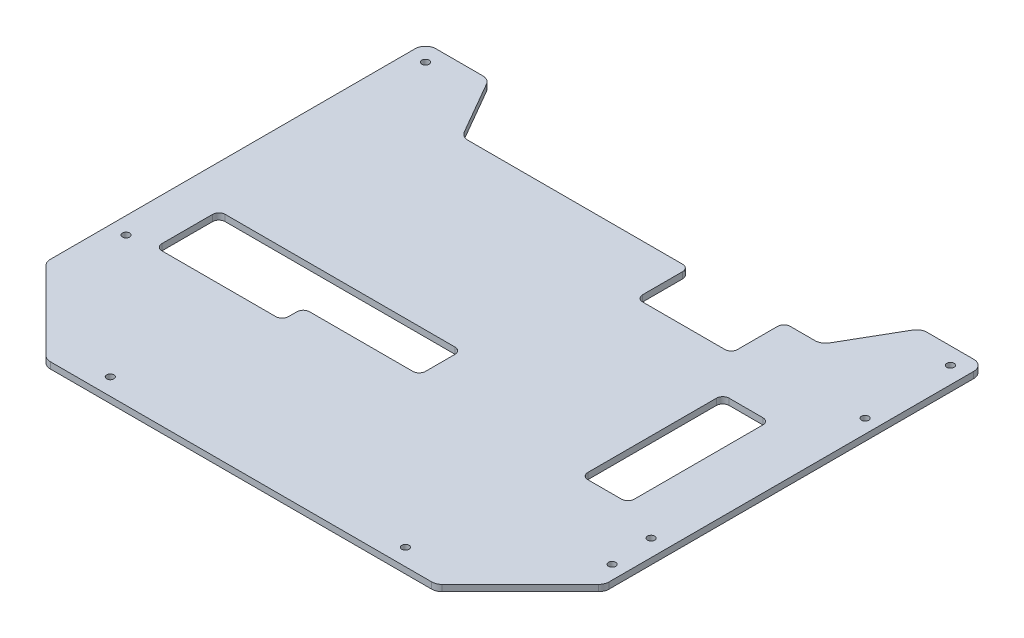
from build123d import *

# Parameters (mm, degrees)
BOSS_EXTRU_1_DEPTH      = 3
CONG_1_R                = 5
ESQUISSE2_R             = 1
ESQUISSE2_R_2           = 1.5
ENL_V_MAT_EXTRU_1_DEPTH = 257.837010573
D_GAGEMENT_M31_D        = 3.4
ESQUISSE5_W             = 45
ESQUISSE5_H             = 25
ESQUISSE5_W_2           = 22
ESQUISSE5_H_2           = 67
ENL_V_MAT_EXTRU_2_DEPTH = 257.837010573
CONG_2_R                = 3


with BuildPart() as part:
    # Esquisse1 → Boss.-Extru.1 (new body)
    with BuildSketch(Plane(origin=(0, 0, 0), x_dir=(1, 0, 0), z_dir=(0, 1, 0))):
        Polygon((-92.5, 0), (92.5, 0), (132.5, 40), (132.5, 220), (102.5, 220), (85.179491924, 190), (-85.179491924, 190), (-102.5, 220), (-132.5, 220), (-132.5, 40), align=None)
    extrude(amount=BOSS_EXTRU_1_DEPTH)

    # Congé1
    cong_1_edges = [part.edges().sort_by_distance(p)[0] for p in [
        (132.5, 1.5, -220),
        (102.5, 1.5, -220),
        (85.179491924, 1.5, -190),
        (-85.179491924, 1.5, -190),
        (-102.5, 1.5, -220),
        (-132.5, 1.5, -220),
        (-132.5, 1.5, -40),
        (-92.5, 1.5, 0),
        (92.5, 1.5, 0),
        (132.5, 1.5, -40),
    ]]
    fillet(cong_1_edges, radius=CONG_1_R)

    # Esquisse2 → Enlèv. mat.-Extru.1 (cut, through all)
    with BuildSketch(Plane.XZ):
        with Locations((-70, -8)):
            Circle(ESQUISSE2_R)
        with Locations((-124.5, -70)):
            Circle(ESQUISSE2_R)
        with Locations((-124.5, -212)):
            Circle(ESQUISSE2_R)
        with Locations((124.5, -212)):
            Circle(ESQUISSE2_R)
        with Locations((124.5, -70)):
            Circle(ESQUISSE2_R)
        with Locations((70, -8)):
            Circle(ESQUISSE2_R)
        with Locations((126, -50)):
            Circle(ESQUISSE2_R_2)
        with Locations((126, -170)):
            Circle(ESQUISSE2_R_2)
    extrude(amount=-ENL_V_MAT_EXTRU_1_DEPTH, mode=Mode.SUBTRACT)

    # Dégagement M31 (through all)
    with Locations(Plane(origin=(0, 0, 0), x_dir=(-1, 0, 0), z_dir=(0, -1, 0))):
        with Locations((-70, 8), (-124.5, 70), (-124.5, 212), (124.5, 212), (124.5, 70), (70, 8), (-126, 170), (-126, 50)):
            Hole(D_GAGEMENT_M31_D / 2)

    # Esquisse5 → Enlèv. mat.-Extru.2 (cut, through all)
    with BuildSketch(Plane.XZ):
        with Locations((45, -177.5)):
            Rectangle(ESQUISSE5_W, ESQUISSE5_H)
        Polygon((-112.5, -82), (-112.5, -72), (-52.5, -72), (-52.5, -82), (2.5, -82), (2.5, -102), (-112.5, -102), align=None)
        with Locations((93.5, -112.5)):
            Rectangle(ESQUISSE5_W_2, ESQUISSE5_H_2)
    extrude(amount=-ENL_V_MAT_EXTRU_2_DEPTH, mode=Mode.SUBTRACT)

    # Congé2
    cong_2_edges = [part.edges().sort_by_distance(p)[0] for p in [
        (67.5, 1.5, -190),
        (67.5, 1.5, -165),
        (22.5, 1.5, -165),
        (22.5, 1.5, -190),
        (104.5, 1.5, -146),
        (82.5, 1.5, -146),
        (82.5, 1.5, -79),
        (104.5, 1.5, -79),
        (2.5, 1.5, -82),
        (2.5, 1.5, -102),
        (-112.5, 1.5, -102),
        (-52.5, 1.5, -72),
        (-52.5, 1.5, -82),
        (-112.5, 1.5, -72),
    ]]
    fillet(cong_2_edges, radius=CONG_2_R)


solid = part.part
